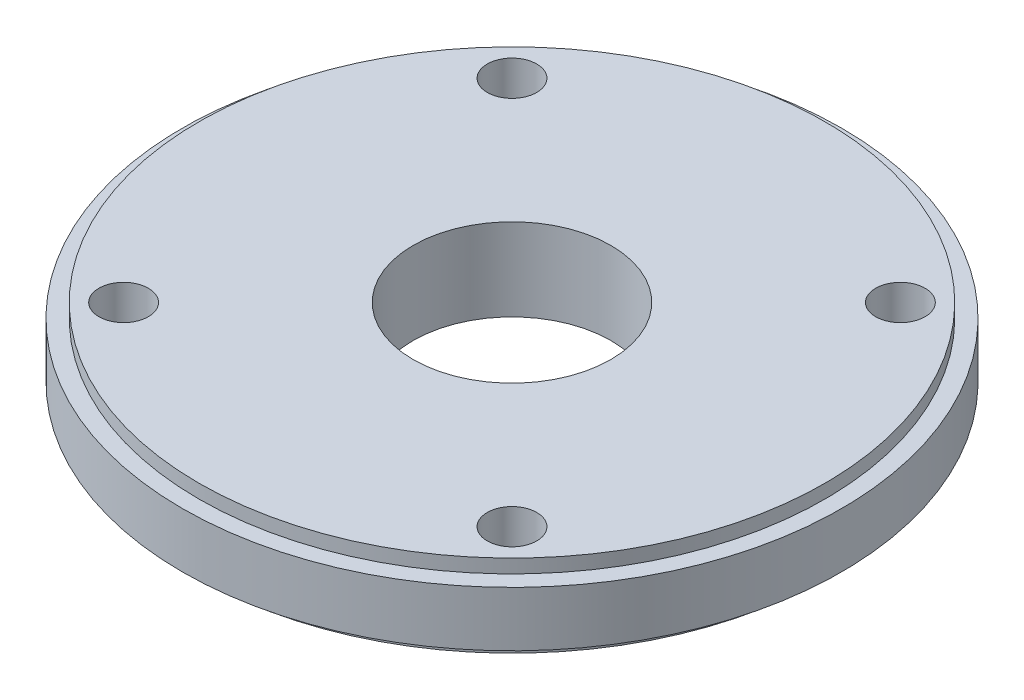
from build123d import *

# Parameters (mm, degrees)
SKETCH1_R            = 57
EXTRUDE4_DEPTH       = 7.5
SKETCH_R             = 60
SKETCH_R_2           = 57
EXTRUDE5_DEPTH       = 5
EXTRUDE6_DEPTH       = 86.183625187
EXTRUDE6_DEPTH_BACK  = 86.183625187
SKETCH5_R            = 18
M8_CLEARANCE_HOLE2_D = 9
CIRPATTERN3_COUNT    = 4


with BuildPart() as part:
    # Sketch1 → Extrude4 (new, symmetric)
    with BuildSketch(Plane(origin=(0, 0, 0), x_dir=(1, 0, 0), z_dir=(0, 1, 0))):
        Circle(SKETCH1_R)
    extrude(amount=EXTRUDE4_DEPTH, both=True)

    # Sketch → Extrude5 (add, symmetric)
    with BuildSketch(Plane(origin=(0, 0, 0), x_dir=(1, 0, 0), z_dir=(0, 1, 0))):
        Circle(SKETCH_R)
        Circle(SKETCH_R_2, mode=Mode.SUBTRACT)
    extrude(amount=EXTRUDE5_DEPTH, both=True)

    # Sketch5 → Extrude6 (cut, two sides: drawn at the far end of the back side and taken through both)
    with BuildSketch(Plane(origin=(0, 0, 0), x_dir=(1, 0, 0), z_dir=(0, 1, 0)).offset(-EXTRUDE6_DEPTH_BACK)):
        Circle(SKETCH5_R)
    extrude(amount=EXTRUDE6_DEPTH + EXTRUDE6_DEPTH_BACK, mode=Mode.SUBTRACT)

    # M8 Clearance Hole2 (through all)
    with Locations(Plane(origin=(0, 7.5, 0), x_dir=(1, 0, 0), z_dir=(0, 1, 0))):
        with Locations((-35.355339059, -35.355339059)):
            m8_clearance_hole2 = Hole(M8_CLEARANCE_HOLE2_D / 2)

    # CirPattern3: M8 Clearance Hole2 ×4 about axis
    cirpattern3_axis = Axis((0, -8.25, 0), (0, 1, 0))
    for i in range(1, CIRPATTERN3_COUNT):
        add(m8_clearance_hole2.rotate(cirpattern3_axis, i * 360 / CIRPATTERN3_COUNT), mode=Mode.SUBTRACT)


solid = part.part
